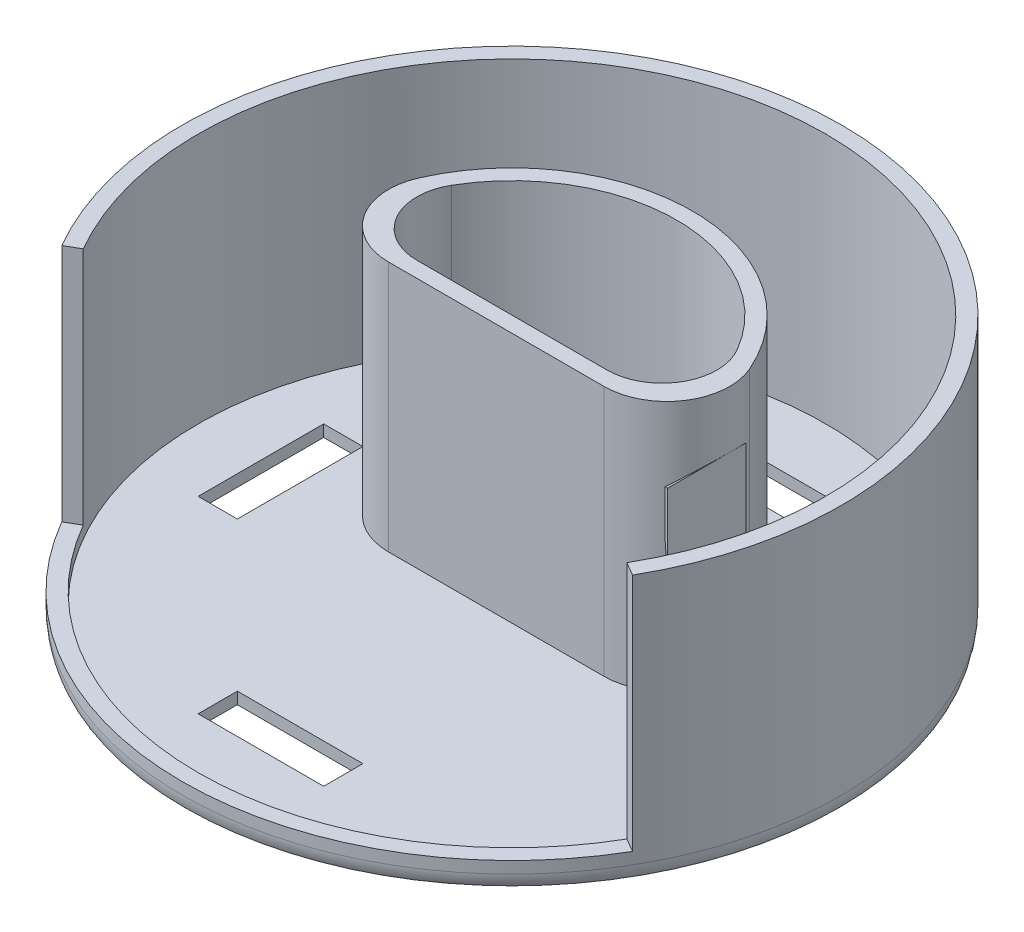
from build123d import *

# Parameters (mm, degrees)
CUT_EXTRUDE1_DEPTH     = 5
CUT_EXTRUDE3_DEPTH     = 45
SKETCH8_R              = 40
CUT_EXTRUDE4_DEPTH     = 32
FILLET1_R              = 7
FILLET2_R              = 8
CUT_REVOLVE1_START     = 17
CUT_REVOLVE1_DEPTH     = 30.5
SKETCH18_W             = 13
SKETCH18_H             = 8
CUT_EXTRUDE13_DEPTH    = 5
SKETCH20_W             = 84
SKETCH20_H             = 7
CUT_EXTRUDE15_DEPTH    = 5
SKETCH19_R             = 1.5
CUT_EXTRUDE14_DEPTH    = 12
FILLET3_R              = 4
SKETCH21_W             = 16
SKETCH21_H             = 5
CUT_EXTRUDE16_DEPTH    = 5
CIRPATTERN1_COUNT      = 4
SKETCH22_W             = 5
SKETCH22_H             = 12
BOSS_EXTRUDE1_DEPTH    = 1.5
SKETCH23_W             = 5
SKETCH23_H             = 4.4
SKETCH23_H_2           = 4
BOSS_EXTRUDE2_DEPTH    = 17
SKETCH24_W             = 2
SKETCH24_H             = 3
BOSS_EXTRUDE3_DEPTH    = 2
CIRPATTERN2_COUNT      = 5
INTERSECT1_START       = 47.5
INTERSECT1_OUTLINE_R   = 42
INTERSECT1_OUTLINE_W   = 13
INTERSECT1_OUTLINE_H   = 8
INTERSECT1_DEPTH       = 7.5
INTERSECT2_OUTLINE_W   = 86
INTERSECT2_OUTLINE_H   = 86
INTERSECT2_OUTLINE_W_2 = 5
INTERSECT2_OUTLINE_H_2 = 16
INTERSECT2_OUTLINE_W_3 = 16
INTERSECT2_OUTLINE_H_3 = 5
INTERSECT2_DEPTH       = 14
SKETCH28_W             = 10
SKETCH28_H             = 10
BOSS_EXTRUDE4_DEPTH    = 2.5
BOSS_EXTRUDE4_DRAFT    = -41


# Read off the part's stored shape, not the designer's step: Cut-Revolve1, Intersect1, Intersect2
with BuildPart() as part:
    # Sketch1 → Revolve1 (revolve)
    with BuildSketch(Plane.XY, mode=Mode.PRIVATE) as revolve1_sk:
        with BuildLine():
            Line((37, 55), (0, 55))
            Line((0, 55), (0, 11.5))
            Line((0, 11.5), (22.5, 11.5))
            Line((22.5, 11.5), (22.5, 0))
            Line((22.5, 0), (25, 0))
            Line((25, 0), (25, 11.5))
            Line((25, 11.5), (42, 11.5))
            Line((42, 11.5), (42, 50))
            ThreePointArc((42, 50), (40.535533906, 53.535533906), (37, 55))
        make_face()
    revolve(revolve1_sk.sketch.rotate(Axis((0, 2, 0), (0, 1, 0)), 90), axis=Axis((0, 2, 0), (0, 1, 0)))

    # Sketch5 → Cut-Extrude1 (cut)
    with BuildSketch(Plane(origin=(0, 55, 0), x_dir=(1, 0, 0), z_dir=(0, 1, 0))):
        with BuildLine():
            Line((-42, 0), (-40, 0))
            Line((-40, 0), (40, 0))
            Line((40, 0), (42, 0))
            ThreePointArc((42, 0), (0, 42), (-42, 0))
        make_face()
    extrude(amount=-CUT_EXTRUDE1_DEPTH, mode=Mode.SUBTRACT)

    # Sketch7 → Cut-Extrude3 (cut)
    with BuildSketch(Plane.XZ.offset(-11.5)):
        with BuildLine():
            Line((-21, 0), (21, 0))
            ThreePointArc((21, 0), (0, -21), (-21, 0))
        make_face()
    extrude(amount=-CUT_EXTRUDE3_DEPTH, mode=Mode.SUBTRACT)

    # Sketch8 → Cut-Extrude4 (cut)
    with BuildSketch(Plane(origin=(0, 47.5, 0), x_dir=(1, 0, 0), z_dir=(0, 1, 0))):
        with Locations(Location((0, 0, 0), (0, 0, 270))):
            Circle(SKETCH8_R)
        with BuildLine():
            Line((22.912878475, -2), (-22.912878475, -2))
            ThreePointArc((-22.912878475, -2), (0, 23), (22.912878475, -2))
        make_face(mode=Mode.SUBTRACT)
    extrude(amount=-CUT_EXTRUDE4_DEPTH, mode=Mode.SUBTRACT)

    # Fillet1
    fillet1_edges = [part.edges().sort_by_distance(p)[0] for p in [
        (21, 30.75, 0),
        (-21, 30.75, 0),
    ]]
    fillet(fillet1_edges, radius=FILLET1_R)

    # Fillet2
    fillet2_edges = [part.edges().sort_by_distance(p)[0] for p in [
        (-22.912878475, 31.5, 2),
        (22.912878475, 31.5, 2),
    ]]
    fillet(fillet2_edges, radius=FILLET2_R)

    # Cut-Revolve1 outline → Cut-Revolve1 (cut)
    with BuildSketch(Plane(origin=(0, 0, 0), x_dir=(1, 0, 0), z_dir=(0, 1, 0)).offset(CUT_REVOLVE1_START)):
        with BuildLine():
            Line((-34.641016151, -20), (-36.373066959, -21))
            ThreePointArc((-36.373066959, -21), (0, -42), (36.373066959, -21))
            Line((36.373066959, -21), (34.641016151, -20))
            ThreePointArc((34.641016151, -20), (0, -40), (-34.641016151, -20))
        make_face()
    extrude(amount=CUT_REVOLVE1_DEPTH, mode=Mode.SUBTRACT)

    # Sketch18 → Cut-Extrude13 (cut)
    with BuildSketch(Plane(origin=(0, 50, 0), x_dir=(1, 0, 0), z_dir=(0, 1, 0))):
        with Locations((0.796512215, 32.951769165)):
            Rectangle(SKETCH18_W, SKETCH18_H)
    extrude(amount=-CUT_EXTRUDE13_DEPTH, mode=Mode.SUBTRACT)

    # Sketch20 → Cut-Extrude15 (cut)
    with BuildSketch(Plane(origin=(0, 55, 0), x_dir=(1, 0, 0), z_dir=(0, 1, 0))):
        with Locations((0, -3.5)):
            Rectangle(SKETCH20_W, SKETCH20_H)
    extrude(amount=-CUT_EXTRUDE15_DEPTH, mode=Mode.SUBTRACT)

    # Sketch19 → Cut-Extrude14 (cut)
    with BuildSketch(Plane(origin=(0, 0, 7), x_dir=(-1, 0, 0), z_dir=(0, 0, -1))):
        with Locations((0, 52.5)):
            Circle(SKETCH19_R)
        with Locations((-29.412558482, 52.5)):
            Circle(SKETCH19_R)
        with Locations((29.412558482, 52.5)):
            Circle(SKETCH19_R)
    extrude(amount=-CUT_EXTRUDE14_DEPTH, mode=Mode.SUBTRACT)

    # Fillet3
    fillet3_edges = [part.edges().sort_by_distance(p)[0] for p in [
        (0, 11.5, 42),
    ]]
    fillet(fillet3_edges, radius=FILLET3_R)

    # Sketch21 → Cut-Extrude16 (cut)
    with BuildSketch(Plane(origin=(0, 15.5, 0), x_dir=(1, 0, 0), z_dir=(0, 1, 0))):
        with Locations((0, -29.5)):
            Rectangle(SKETCH21_W, SKETCH21_H)
    cut_extrude16 = extrude(amount=-CUT_EXTRUDE16_DEPTH, mode=Mode.SUBTRACT)

    # CirPattern1: Cut-Extrude16 ×4 about axis
    cirpattern1_axis = Axis((0, 0, 0), (0, 1, 0))
    for i in range(1, CIRPATTERN1_COUNT):
        add(cut_extrude16.rotate(cirpattern1_axis, i * 360 / CIRPATTERN1_COUNT), mode=Mode.SUBTRACT)

    # Sketch22 → Boss-Extrude1 (add)
    with BuildSketch(Plane(origin=(0, 15.5, 0), x_dir=(1, 0, 0), z_dir=(0, 1, 0))):
        with Locations((35.5, -4)):
            Rectangle(SKETCH22_W, SKETCH22_H)
    extrude(amount=BOSS_EXTRUDE1_DEPTH)

    # Sketch23 → Boss-Extrude2 (add)
    with BuildSketch(Plane(origin=(0, 17, 0), x_dir=(1, 0, 0), z_dir=(0, 1, 0))):
        with Locations((35.5, -0.2)):
            Rectangle(SKETCH23_W, SKETCH23_H)
        with Locations((35.5, -8)):
            Rectangle(SKETCH23_W, SKETCH23_H_2)
    extrude(amount=BOSS_EXTRUDE2_DEPTH)

    # Sketch24 → Boss-Extrude3 (add)
    with BuildSketch(Plane.XZ):
        with Locations((0, -22.5)):
            Rectangle(SKETCH24_W, SKETCH24_H)
    boss_extrude3 = extrude(amount=-BOSS_EXTRUDE3_DEPTH)

    # CirPattern2: Boss-Extrude3 ×5 about axis
    cirpattern2_axis = Axis((0, 0, 0), (0, 1, 0))
    for i in range(1, CIRPATTERN2_COUNT):
        add(boss_extrude3.rotate(cirpattern2_axis, i * 360 / CIRPATTERN2_COUNT))

    # Intersect1 outline → Intersect1 (cut)
    with BuildSketch(Plane(origin=(0, 0, 0), x_dir=(1, 0, 0), z_dir=(0, 1, 0)).offset(INTERSECT1_START)):
        Circle(INTERSECT1_OUTLINE_R)
        with BuildLine():
            Line((12.124355653, 0), (-12.124355653, 0))
            ThreePointArc((-12.124355653, 0), (-18.186533479, 3.5), (-18.186533479, 10.5))
            ThreePointArc((-18.186533479, 10.5), (0, 21), (18.186533479, 10.5))
            ThreePointArc((18.186533479, 10.5), (18.186533479, 3.5), (12.124355653, 0))
        make_face(mode=Mode.SUBTRACT)
        with Locations((0.796512215, 32.951769165)):
            Rectangle(INTERSECT1_OUTLINE_W, INTERSECT1_OUTLINE_H, mode=Mode.SUBTRACT)
    extrude(amount=INTERSECT1_DEPTH, mode=Mode.SUBTRACT)

    # Intersect2 outline → Intersect2 (cut)
    with BuildSketch(Plane(origin=(0, 0, 0), x_dir=(1, 0, 0), z_dir=(0, 1, 0))):
        Rectangle(INTERSECT2_OUTLINE_W, INTERSECT2_OUTLINE_H)
        with Locations((29.5, 0)):
            Rectangle(INTERSECT2_OUTLINE_W_2, INTERSECT2_OUTLINE_H_2, mode=Mode.SUBTRACT)
        with Locations((0, -29.5)):
            Rectangle(INTERSECT2_OUTLINE_W_3, INTERSECT2_OUTLINE_H_3, mode=Mode.SUBTRACT)
        with Locations((0, 29.5)):
            Rectangle(INTERSECT2_OUTLINE_W_3, INTERSECT2_OUTLINE_H_3, mode=Mode.SUBTRACT)
        with Locations((-29.5, 0)):
            Rectangle(INTERSECT2_OUTLINE_W_2, INTERSECT2_OUTLINE_H_2, mode=Mode.SUBTRACT)
    extrude(amount=INTERSECT2_DEPTH, mode=Mode.SUBTRACT)


with BuildPart() as boss_extrude4_tool:
    # Sketch28 → Boss-Extrude4 (with draft: the straight prism first)
    with BuildSketch(Plane(origin=(21.747727085, 0, 0), x_dir=(0, 0, -1), z_dir=(1, 0, 0))):
        with Locations((3.079158512, 35.232399588)):
            Rectangle(SKETCH28_W, SKETCH28_H)
    extrude(amount=-BOSS_EXTRUDE4_DEPTH)
    # Boss-Extrude4: the draft: its side faces are tilted about the plane it starts from
    boss_extrude4_sides = [boss_extrude4_tool.faces().sort_by_distance(p)[0] for p in [
        (20.497727085, 35.232399588, 1.920841488),
        (20.497727085, 30.232399588, -3.079158512),
        (20.497727085, 35.232399588, -8.079158512),
        (20.497727085, 40.232399588, -3.079158512),
    ]]
    draft(boss_extrude4_sides, Plane(origin=(21.747727085, 0, 0), x_dir=(0, 0, -1), z_dir=(1, 0, 0)), BOSS_EXTRUDE4_DRAFT)


with BuildPart() as part_1:
    add(part.part)

    # Boss-Extrude4: add boss_extrude4_tool
    add(boss_extrude4_tool.part)


solid = part_1.part
